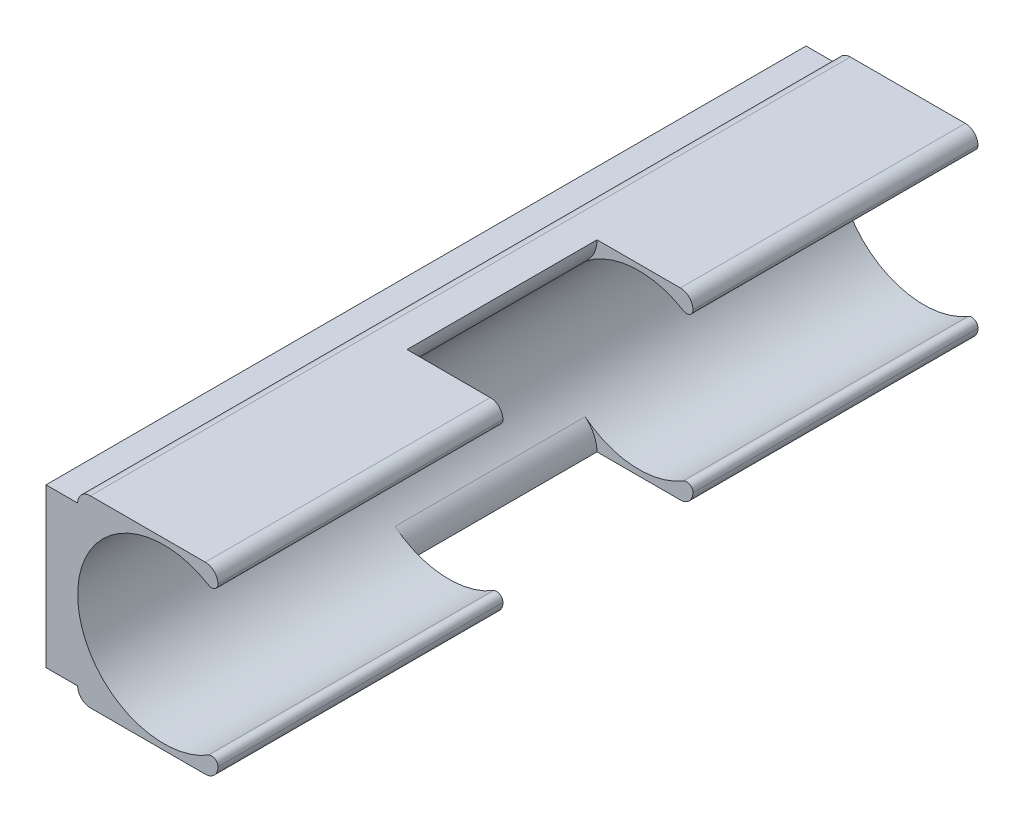
from build123d import *

# Parameters (mm, degrees)
SKETCH1_W        = 120
SKETCH1_H        = 25
BASE_DEPTH       = 5
CLIP_DEPTH       = 120
SKETCH3_R        = 1.5
SCREWHOLES_DEPTH = 3
ROUNDEDCORNERS_R = 1
SKETCH4_W        = 15.150992531
SKETCH4_H        = 29
FINGERGAP_DEPTH  = 15
FINGERGROOVE_R   = 5


with BuildPart() as part:
    # Sketch1 → Base (new body)
    with BuildSketch(Plane(origin=(0, 0, 0), x_dir=(0, 0, -1), z_dir=(1, 0, 0))):
        with Locations((60, 12.5)):
            Rectangle(SKETCH1_W, SKETCH1_H)
    extrude(amount=BASE_DEPTH)

    # Sketch2 → Clip (add)
    with BuildSketch(Plane.XY):
        with BuildLine():
            Line((25.150992531, 27), (7, 27))
            ThreePointArc((7, 27), (5.585786438, 26.414213562), (5, 25))
            Line((5, 25), (5, 12.5))
            ThreePointArc((5, 12.5), (12.740541767, 24.773008971), (27.150992531, 23.075468156))
            Line((27.150992531, 23.075468156), (27.150992531, 25))
            ThreePointArc((27.150992531, 25), (26.565206094, 26.414213562), (25.150992531, 27))
        make_face()
        with BuildLine():
            ThreePointArc((27.150992531, 1.924531844), (12.740541767, 0.226991029), (5, 12.5))
            Line((5, 12.5), (5, 0))
            ThreePointArc((5, 0), (5.585786438, -1.414213562), (7, -2))
            Line((7, -2), (25.150992531, -2))
            ThreePointArc((25.150992531, -2), (26.565206094, -1.414213562), (27.150992531, 0))
            Line((27.150992531, 0), (27.150992531, 1.924531844))
        make_face()
    extrude(amount=-CLIP_DEPTH)

    # Sketch3 → ScrewHoles (cut)
    with BuildSketch(Plane.ZY):
        with Locations((-100, 12.5)):
            Circle(SKETCH3_R)
        with Locations(Location((-20, 12.5, 0), (0, 0, 180))):
            Circle(SKETCH3_R)
    extrude(amount=-SCREWHOLES_DEPTH, mode=Mode.SUBTRACT)

    # RoundedCorners
    roundedcorners_edges = [part.edges().sort_by_distance(p)[0] for p in [
        (27.150992531, 23.075468156, -60),
        (27.150992531, 1.924531844, -60),
    ]]
    fillet(roundedcorners_edges, radius=ROUNDEDCORNERS_R)

    # Sketch4 → FingerGap (cut, symmetric)
    with BuildSketch(Plane(origin=(0, 0, -60), x_dir=(-1, 0, 0), z_dir=(0, 0, -1))):
        with Locations((-19.575496265, 12.5)):
            Rectangle(SKETCH4_W, SKETCH4_H)
    extrude(amount=FINGERGAP_DEPTH, both=True, mode=Mode.SUBTRACT)

    # FingerGroove
    # the kernel refuses this fillet: 5 mm, written as the material it takes off along each edge
    with BuildSketch(Plane(origin=(12, 0.608826803, -75), x_dir=(-0.8309099585253181, 0.5564069022068779, 0), z_dir=(0, 0, 1))) as fingergroove_piece_1:
        with BuildLine():
            CenterArc((2.68094623, 4.982639626), FINGERGROOVE_R, 213.807673482, 51.416397028)
            Line((-1.473603562, 2.200605115), (0, 0))
            ThreePointArc((0, 0), (1.132325116, 0.047220218), (2.264650232, 0))
        make_face()
    extrude(amount=30, mode=Mode.SUBTRACT)
    with BuildSketch(Plane(origin=(12, 24.391173197, -75), x_dir=(-0.8309099585253178, -0.5564069022068784, 0), z_dir=(0, 0, 1))) as fingergroove_piece_2:
        with BuildLine():
            CenterArc((2.68094623, -4.982639626), FINGERGROOVE_R, 94.77592949, 51.416397028)
            Line((-1.473603562, -2.200605115), (0, 0))
            ThreePointArc((0, 0), (1.132325116, -0.047220218), (2.264650232, 0))
        make_face()
    extrude(amount=30, mode=Mode.SUBTRACT)


solid = part.part
